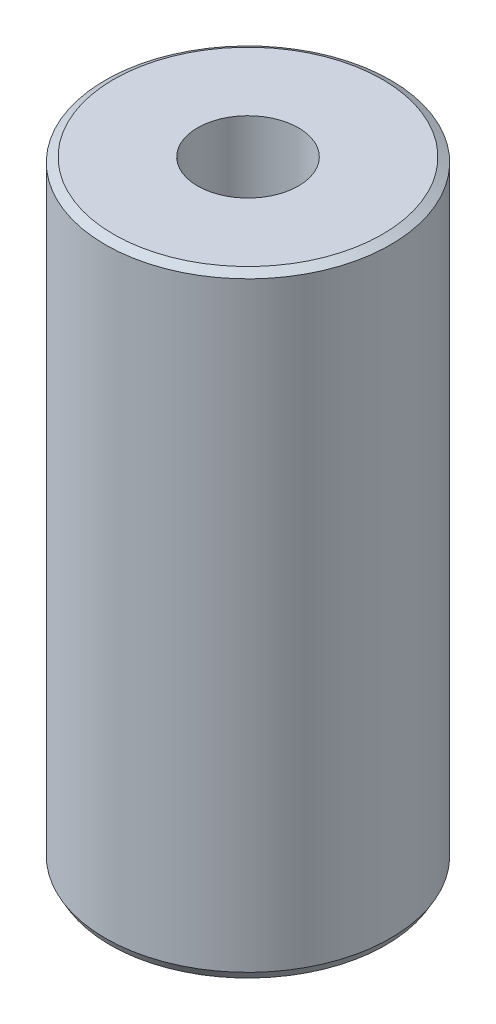
from build123d import *
from OCP.BRepFilletAPI import BRepFilletAPI_MakeChamfer

# Parameters (mm, degrees)
SKETCH1_R           = 60
BOSS_EXTRUDE1_DEPTH = 258.179872806
SKETCH2_R           = 21.224364142
CUT_EXTRUDE1_DEPTH  = 272.766161842
CHAMFER1_SIZE       = 2.019416404
CHAMFER1_SIZE2      = 3.497731813


with BuildPart() as part:
    # Sketch1 → Boss-Extrude1 (new body)
    with BuildSketch(Plane(origin=(0, 0, 0), x_dir=(1, 0, 0), z_dir=(0, 1, 0))):
        Circle(SKETCH1_R)
    extrude(amount=BOSS_EXTRUDE1_DEPTH)

    # Sketch2 → Cut-Extrude1 (cut, through all)
    with BuildSketch(Plane(origin=(0, 0, 0), x_dir=(1, 0, 0), z_dir=(0, 1, 0))):
        Circle(SKETCH2_R)
    extrude(amount=CUT_EXTRUDE1_DEPTH, mode=Mode.SUBTRACT)

    # Chamfer1: one chamfer whose edges measure the first distance from different faces: ONE call of the kernel's chamfer builder (chamfer() names one face for all edges)
    chamfer1_edges_1 = [part.edges().sort_by_distance(p)[0] for p in [
        (-60, 258.179872806, 0),
    ]]
    chamfer1_side_1 = [part.faces().sort_by_distance(p)[0] for p in [
        (-60, 129.089936403, 0),
    ]]
    chamfer1_edges_2 = [part.edges().sort_by_distance(p)[0] for p in [
        (-60, 0, 0),
    ]]
    chamfer1_side_2 = [part.faces().sort_by_distance(p)[0] for p in [
        (-58.302943725, 0, 0),
    ]]
    chamfer1 = BRepFilletAPI_MakeChamfer(part.part.solid().wrapped)
    for e in chamfer1_edges_1:
        chamfer1.Add(CHAMFER1_SIZE, CHAMFER1_SIZE2, e.wrapped, chamfer1_side_1[0].wrapped)  # the first distance lies on this face
    for e in chamfer1_edges_2:
        chamfer1.Add(CHAMFER1_SIZE, CHAMFER1_SIZE2, e.wrapped, chamfer1_side_2[0].wrapped)  # the first distance lies on this face
    add(Compound.cast(chamfer1.Shape()), mode=Mode.REPLACE)


solid = part.part
